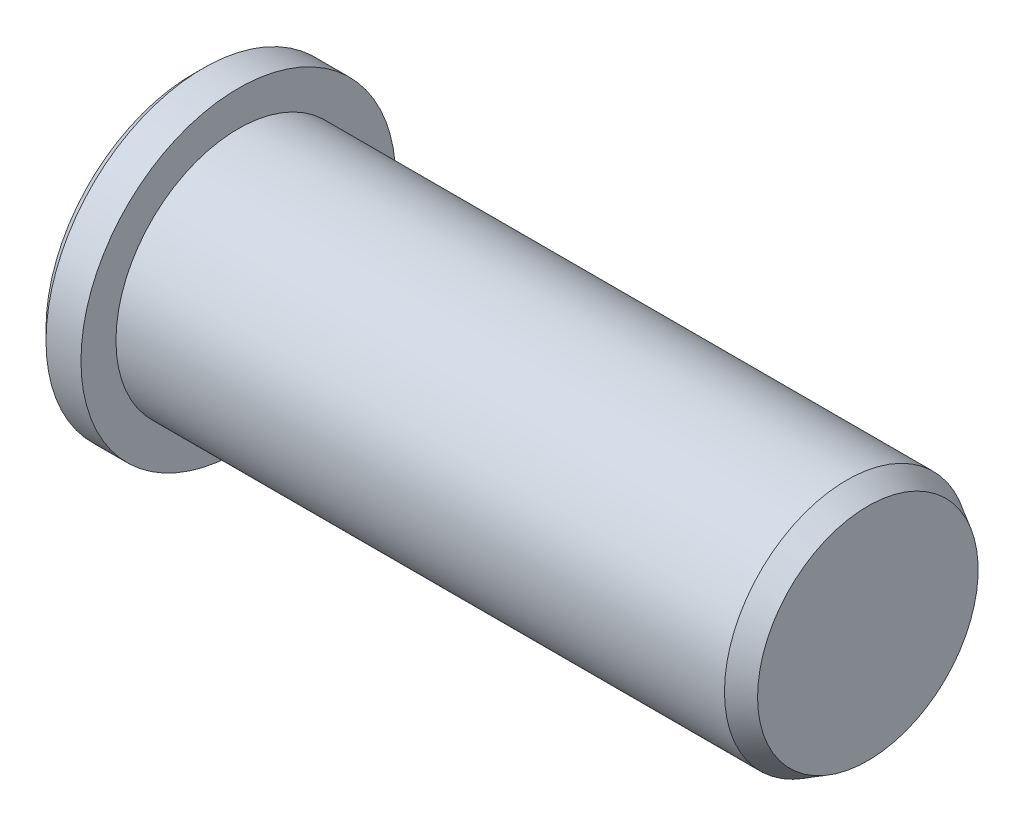
from build123d import *


with BuildPart() as part:
    # BodySke → BaseBody (revolve)
    with BuildSketch(Plane.XY):
        Polygon((0, 0), (0, 42), (3, 45), (13, 45), (13, 35), (187, 35), (193, 31.535898385), (193, 0), align=None)
    revolve(axis=Axis((0, 0, 0), (1, 0, 0)))


solid = part.part
